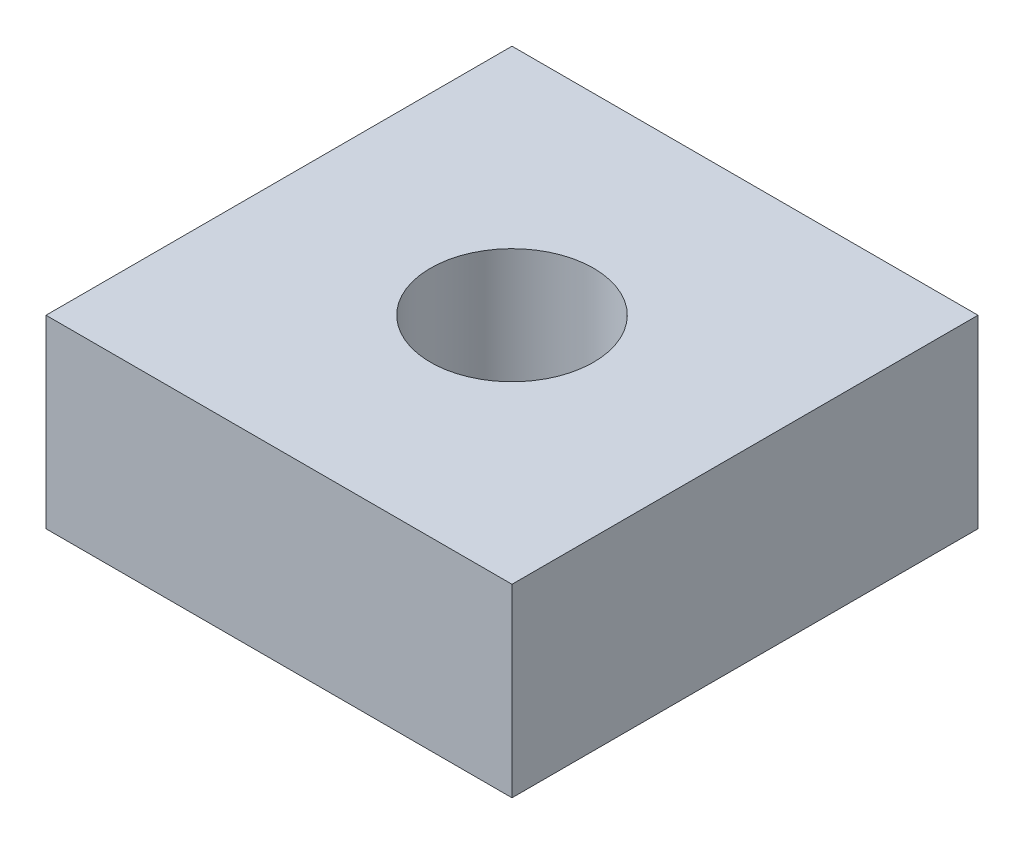
from build123d import *

# Parameters (mm, degrees)
SKETCH2_W           = 12
SKETCH2_H           = 12
SKETCH2_R           = 2.1
BOSS_EXTRUDE1_DEPTH = 4.7625


with BuildPart() as part:
    # Sketch2 → Boss-Extrude1 (new body)
    with BuildSketch(Plane(origin=(0, 0, 0), x_dir=(1, 0, 0), z_dir=(0, 1, 0))):
        with Locations((-6, 6)):
            Rectangle(SKETCH2_W, SKETCH2_H)
        with Locations((-6, 6)):
            Circle(SKETCH2_R, mode=Mode.SUBTRACT)
    extrude(amount=BOSS_EXTRUDE1_DEPTH)


solid = part.part
